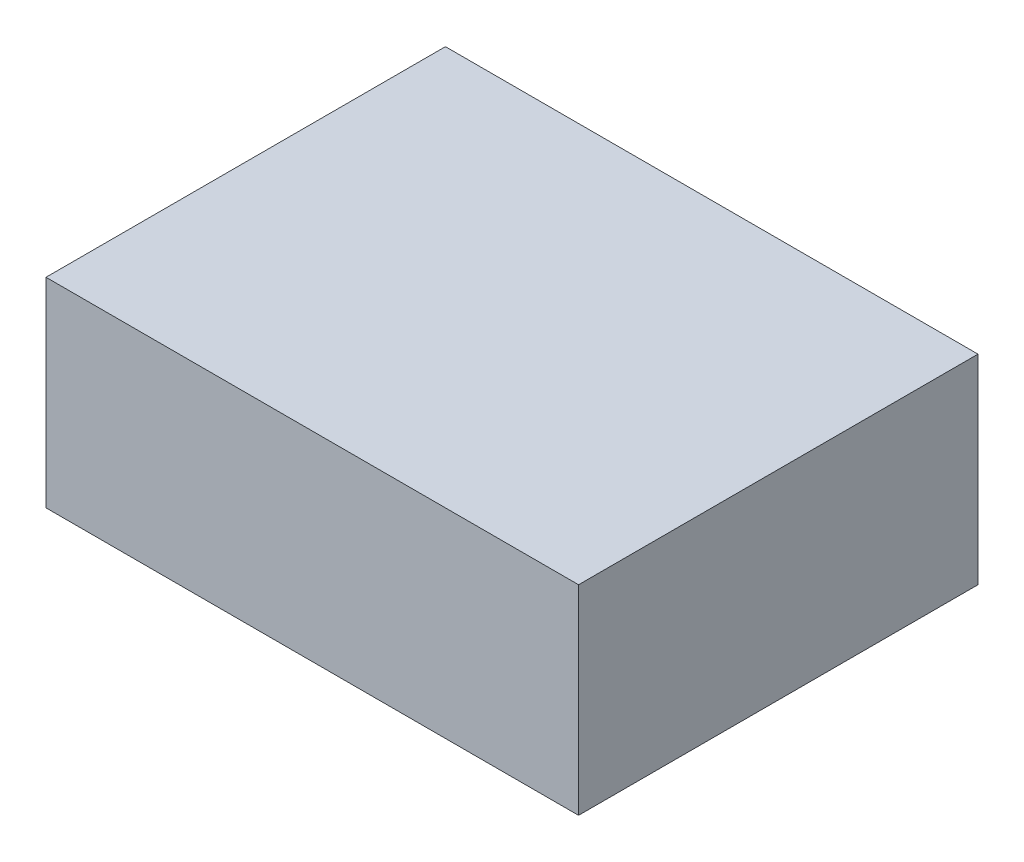
from build123d import *

# Parameters (mm, degrees)
SKETCH2_W          = 203.2
SKETCH2_H          = 152.4
LINK2_DEPTH        = 76.2
SKETCH3_R          = 25.4
CUT_EXTRUDE1_DEPTH = 25.4
SKETCH4_W          = 127
SKETCH4_H          = 25.4
CUT_EXTRUDE2_DEPTH = 177.8


with BuildPart() as part:
    # Sketch2 → link2 (new body)
    with BuildSketch(Plane(origin=(0, 0, 0), x_dir=(1, 0, 0), z_dir=(0, 1, 0))):
        Rectangle(SKETCH2_W, SKETCH2_H)
    extrude(amount=LINK2_DEPTH)

    # Sketch3 → Cut-Extrude1 (cut)
    with BuildSketch(Plane.XZ):
        with Locations((50.8, 0)):
            Circle(SKETCH3_R)
    extrude(amount=-CUT_EXTRUDE1_DEPTH, mode=Mode.SUBTRACT)

    # Sketch4 → Cut-Extrude2 (cut)
    with BuildSketch(Plane.ZY.offset(101.6)):
        with Locations((0, 50.8)):
            Rectangle(SKETCH4_W, SKETCH4_H)
    extrude(amount=-CUT_EXTRUDE2_DEPTH, mode=Mode.SUBTRACT)


solid = part.part
